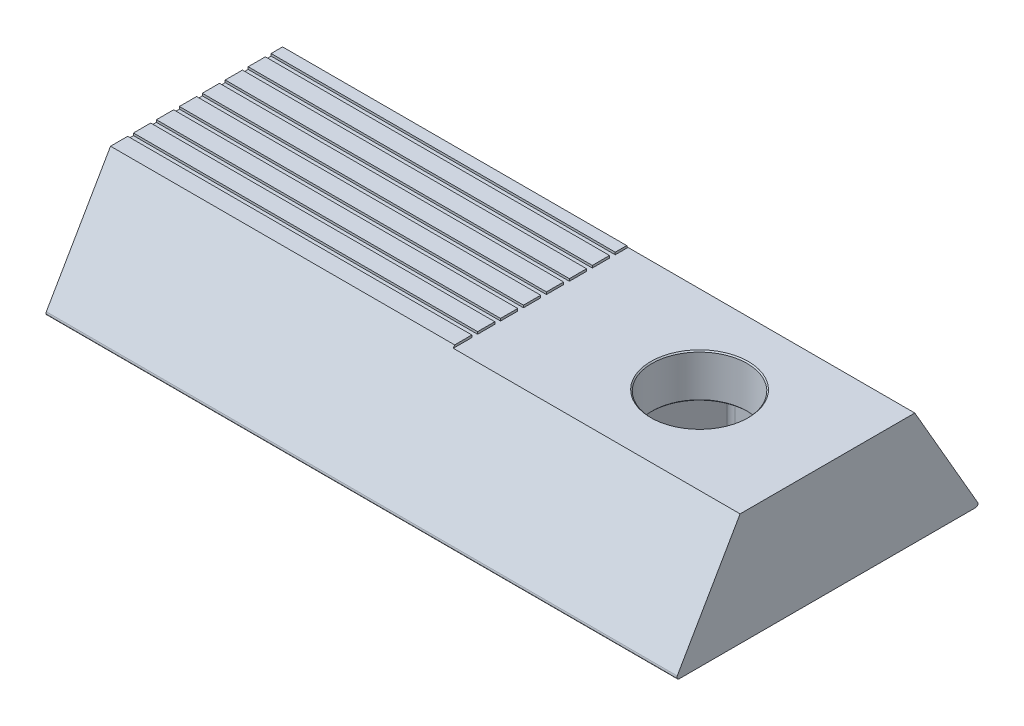
from build123d import *

# Parameters (mm, degrees)
SKETCH1_R                       = 4.15
BOSS_EXTRUDE1_DEPTH             = 10
CUT_EXTRUDE2_DEPTH              = 42.907636536
CUT_EXTRUDE2_DEPTH_BACK         = 42.907636536
SKETCH2_W                       = 0.5
SKETCH2_H                       = 0.2
BOSS_EXTRUDE2_REACH             = 43.908
BOSS_EXTRUDE2_DIRECTION_2_REACH = 43.908
SKETCH10_W                      = 15.230940108
SKETCH10_H                      = 0.2
CUT_EXTRUDE6_DEPTH              = 25
CUT_EXTRUDE5_DEPTH              = 6
FILLET3_R                       = 0.5
CHAMFER1_SIZE                   = 0.1


with BuildPart() as part:
    # Sketch1 → Boss-Extrude1 (new body)
    with BuildSketch(Plane(origin=(0, 0, 0), x_dir=(1, 0, 0), z_dir=(0, 1, 0))):
        Polygon((-15, -7.5), (15, -7.5), (40, -7.5), (40, 7.5), (15, 7.5), (-15, 7.5), align=None)
        with Locations((28.85, 0)):
            Circle(SKETCH1_R, mode=Mode.SUBTRACT)
    extrude(amount=BOSS_EXTRUDE1_DEPTH)

    # Sketch2 → Cut-Extrude2 (cut, two sides: drawn at the far end of the back side and taken through both)
    with BuildSketch(Plane(origin=(0, 0, 0), x_dir=(0, 0, -1), z_dir=(1, 0, 0)).offset(-CUT_EXTRUDE2_DEPTH_BACK)):
        with Locations((-5.75, 9.9)):
            Rectangle(SKETCH2_W, SKETCH2_H)
        with Locations((-3.75, 9.9)):
            Rectangle(SKETCH2_W, SKETCH2_H)
        with Locations((-1.75, 9.9)):
            Rectangle(SKETCH2_W, SKETCH2_H)
        with Locations((0.25, 9.9)):
            Rectangle(SKETCH2_W, SKETCH2_H)
        with Locations((2.25, 9.9)):
            Rectangle(SKETCH2_W, SKETCH2_H)
        with Locations((4.25, 9.9)):
            Rectangle(SKETCH2_W, SKETCH2_H)
        with Locations((6.25, 9.9)):
            Rectangle(SKETCH2_W, SKETCH2_H)
    extrude(amount=CUT_EXTRUDE2_DEPTH + CUT_EXTRUDE2_DEPTH_BACK, mode=Mode.SUBTRACT)

    # Boss-Extrude2: up to this face of the body (flat: up to its plane)
    boss_extrude2_end = Plane(part.part.faces().sort_by_distance((40, 4.977026122, 0.001172137))[0])
    # Sketch3 → Boss-Extrude2 (add, up to the picked face)
    with BuildSketch(Plane(origin=(0, 0, 0), x_dir=(0, 0, -1), z_dir=(1, 0, 0)), mode=Mode.PRIVATE) as boss_extrude2_sk1:
        with BuildLine():
            Line((7.5, 10), (13.097822121, 0.304287674))
            ThreePointArc((13.097822121, 0.304287674), (13.097822121, 0.101429225), (12.92214155, 0))
            Line((12.92214155, 0), (7.5, 0))
            Line((7.5, 0), (7.5, 10))
        make_face()
    boss_extrude2_tool1 = split(extrude(boss_extrude2_sk1.sketch, amount=BOSS_EXTRUDE2_REACH, mode=Mode.PRIVATE), bisect_by=boss_extrude2_end, keep=Keep.BOTH, mode=Mode.PRIVATE)
    # Sketch3 → Boss-Extrude2 (add, up to the picked face)
    with BuildSketch(Plane(origin=(0, 0, 0), x_dir=(0, 0, -1), z_dir=(1, 0, 0)), mode=Mode.PRIVATE) as boss_extrude2_sk2:
        with BuildLine():
            Line((-7.5, 0), (-7.5, 10))
            Line((-7.5, 10), (-13.097822121, 0.304287674))
            ThreePointArc((-13.097822121, 0.304287674), (-13.097822121, 0.101429225), (-12.92214155, 0))
            Line((-12.92214155, 0), (-7.5, 0))
        make_face()
    boss_extrude2_tool2 = split(extrude(boss_extrude2_sk2.sketch, amount=BOSS_EXTRUDE2_REACH, mode=Mode.PRIVATE), bisect_by=boss_extrude2_end, keep=Keep.BOTH, mode=Mode.PRIVATE)
    add(boss_extrude2_tool1.solids().sort_by(Axis((0, 3.336518, -9.420866), (1, 0, 0)))[0])
    add(boss_extrude2_tool2.solids().sort_by(Axis((0, 3.336518, 9.420866), (1, 0, 0)))[0])

    # Boss-Extrude2 direction 2: up to this face of the body (flat: up to its plane)
    boss_extrude2_direction_2_end = Plane(part.part.faces().sort_by_distance((-15, 4.977026122, 0.001172137))[0])
    # Sketch3 → Boss-Extrude2 direction 2 (add, up to the picked face)
    with BuildSketch(Plane(origin=(0, 0, 0), x_dir=(0, 0, -1), z_dir=(1, 0, 0)), mode=Mode.PRIVATE) as boss_extrude2_direction_2_sk1:
        with BuildLine():
            Line((7.5, 10), (13.097822121, 0.304287674))
            ThreePointArc((13.097822121, 0.304287674), (13.097822121, 0.101429225), (12.92214155, 0))
            Line((12.92214155, 0), (7.5, 0))
            Line((7.5, 0), (7.5, 10))
        make_face()
    boss_extrude2_direction_2_tool1 = split(extrude(boss_extrude2_direction_2_sk1.sketch, amount=-BOSS_EXTRUDE2_DIRECTION_2_REACH, mode=Mode.PRIVATE), bisect_by=boss_extrude2_direction_2_end, keep=Keep.BOTH, mode=Mode.PRIVATE)
    # Sketch3 → Boss-Extrude2 direction 2 (add, up to the picked face)
    with BuildSketch(Plane(origin=(0, 0, 0), x_dir=(0, 0, -1), z_dir=(1, 0, 0)), mode=Mode.PRIVATE) as boss_extrude2_direction_2_sk2:
        with BuildLine():
            Line((-7.5, 0), (-7.5, 10))
            Line((-7.5, 10), (-13.097822121, 0.304287674))
            ThreePointArc((-13.097822121, 0.304287674), (-13.097822121, 0.101429225), (-12.92214155, 0))
            Line((-12.92214155, 0), (-7.5, 0))
        make_face()
    boss_extrude2_direction_2_tool2 = split(extrude(boss_extrude2_direction_2_sk2.sketch, amount=-BOSS_EXTRUDE2_DIRECTION_2_REACH, mode=Mode.PRIVATE), bisect_by=boss_extrude2_direction_2_end, keep=Keep.BOTH, mode=Mode.PRIVATE)
    add(boss_extrude2_direction_2_tool1.solids().sort_by(Axis((0, 3.336518, -9.420866), (-1, 0, 0)))[0])
    add(boss_extrude2_direction_2_tool2.solids().sort_by(Axis((0, 3.336518, 9.420866), (-1, 0, 0)))[0])

    # Sketch10 → Cut-Extrude6 (cut)
    with BuildSketch(Plane(origin=(40, 0, 0), x_dir=(0, 0, -1), z_dir=(1, 0, 0))):
        with Locations((0, 9.9)):
            Rectangle(SKETCH10_W, SKETCH10_H)
    extrude(amount=-CUT_EXTRUDE6_DEPTH, mode=Mode.SUBTRACT)

    # Sketch8 → Cut-Extrude5 (cut)
    with BuildSketch(Plane.XZ):
        Polygon((25.039488223, -6.6), (32.660511777, -6.6), (36.471023553, 0), (32.660511777, 6.6), (25.039488223, 6.6), (21.228976447, 0), align=None)
    extrude(amount=-CUT_EXTRUDE5_DEPTH, mode=Mode.SUBTRACT)

    # Fillet3
    fillet3_edges = [part.edges().sort_by_distance(p)[0] for p in [
        (32.660511777, 3, -6.6),
        (25.039488223, 3, -6.6),
        (21.228976447, 3, 0),
        (25.039488223, 3, 6.6),
        (32.660511777, 3, 6.6),
        (36.471023553, 3, 0),
    ]]
    fillet(fillet3_edges, radius=FILLET3_R)

    # Chamfer1
    chamfer1_edges = [part.edges().sort_by_distance(p)[0] for p in [
        (24.7, 6, 0),
        (24.7, 9.8, 0),
    ]]
    chamfer(chamfer1_edges, length=CHAMFER1_SIZE)


solid = part.part
